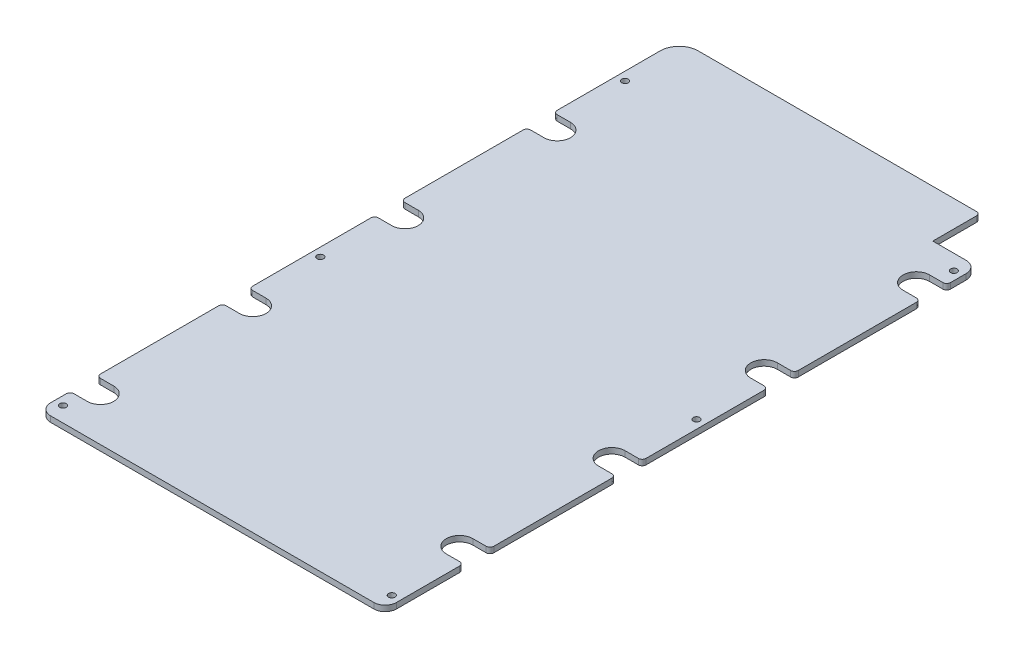
from build123d import *

# Parameters (mm, degrees)
BOSS_EXTRUDE1_DEPTH       = 3
FILLET1_R                 = 10
FILLET2_R                 = 6
F_4_CLEARANCE_HOLE1_D     = 3.4544
F_4_CLEARANCE_HOLE1_DEPTH = 3
F_4_CLEARANCE_HOLE1_TIP   = 1.037806461
FILLET3_R                 = 2


with BuildPart() as part:
    # Sketch1 → Boss-Extrude1 (new body)
    with BuildSketch(Plane(origin=(0, 0, 0), x_dir=(1, 0, 0), z_dir=(0, 1, 0))):
        with BuildLine():
            Line((-91.15, 34.609827366), (-82.15, 34.609827366))
            ThreePointArc((-82.15, 34.609827366), (-75.15, 27.609827366), (-82.15, 20.609827366))
            Line((-82.15, 20.609827366), (-91.15, 20.609827366))
            Line((-91.15, 20.609827366), (-91.15, -45.640172634))
            Line((-91.15, -45.640172634), (-82.15, -45.640172634))
            ThreePointArc((-82.15, -45.640172634), (-75.15, -52.640172634), (-82.15, -59.640172634))
            Line((-82.15, -59.640172634), (-91.15, -59.640172634))
            Line((-91.15, -59.640172634), (-91.15, -125.890172634))
            Line((-91.15, -125.890172634), (-82.15, -125.890172634))
            ThreePointArc((-82.15, -125.890172634), (-75.15, -132.890172634), (-82.15, -139.890172634))
            Line((-82.15, -139.890172634), (-91.15, -139.890172634))
            Line((-91.15, -139.890172634), (-91.15, -156.140172634))
            Line((-91.15, -156.140172634), (91.15, -156.140172634))
            Line((91.15, -156.140172634), (91.15, -114.890172634))
            Line((91.15, -114.890172634), (82.15, -114.890172634))
            ThreePointArc((82.15, -114.890172634), (75.15, -107.890172634), (82.15, -100.890172634))
            Line((82.15, -100.890172634), (91.15, -100.890172634))
            Line((91.15, -100.890172634), (91.15, -34.640172634))
            Line((91.15, -34.640172634), (82.15, -34.640172634))
            ThreePointArc((82.15, -34.640172634), (75.15, -27.640172634), (82.15, -20.640172634))
            Line((82.15, -20.640172634), (91.15, -20.640172634))
            Line((91.15, -20.640172634), (91.15, 45.609827366))
            Line((91.15, 45.609827366), (82.15, 45.609827366))
            ThreePointArc((82.15, 45.609827366), (75.15, 52.609827366), (82.15, 59.609827366))
            Line((82.15, 59.609827366), (91.15, 59.609827366))
            Line((91.15, 59.609827366), (91.15, 125.859827366))
            Line((91.15, 125.859827366), (82.15, 125.859827366))
            ThreePointArc((82.15, 125.859827366), (75.15, 132.859827366), (82.15, 139.859827366))
            Line((82.15, 139.859827366), (91.15, 139.859827366))
            Line((91.15, 139.859827366), (91.15, 156.140172634))
            Line((91.15, 156.140172634), (67.54, 156.140172634))
            Line((67.54, 156.140172634), (67.54, 181.140172634))
            Line((67.54, 181.140172634), (-91.15, 181.140172634))
            Line((-91.15, 181.140172634), (-91.15, 114.859827366))
            Line((-91.15, 114.859827366), (-82.15, 114.859827366))
            ThreePointArc((-82.15, 114.859827366), (-75.15, 107.859827366), (-82.15, 100.859827366))
            Line((-82.15, 100.859827366), (-91.15, 100.859827366))
            Line((-91.15, 100.859827366), (-91.15, 34.609827366))
        make_face()
    extrude(amount=BOSS_EXTRUDE1_DEPTH)

    # Fillet1
    fillet1_edges = [part.edges().sort_by_distance(p)[0] for p in [
        (-91.15, 1.5, -181.140172634),
    ]]
    fillet(fillet1_edges, radius=FILLET1_R)

    # Fillet2
    fillet2_edges = [part.edges().sort_by_distance(p)[0] for p in [
        (91.15, 1.5, 156.140172634),
        (-91.15, 1.5, 156.140172634),
        (91.15, 1.5, -156.140172634),
    ]]
    fillet(fillet2_edges, radius=FILLET2_R)

    # #4 Clearance Hole1
    with Locations(Plane(origin=(0, 3, 0), x_dir=(1, 0, 0), z_dir=(0, 1, 0))):
        with Locations((86.65, 148.140172634), (-86.65, -148.140172634), (-86.65, -12.515172634), (-86.65, 148.140172634), (86.65, 12.484827366), (86.65, -148.140172634)):
            Hole(F_4_CLEARANCE_HOLE1_D / 2, depth=F_4_CLEARANCE_HOLE1_DEPTH)
            with Locations((0, 0, -(F_4_CLEARANCE_HOLE1_DEPTH + F_4_CLEARANCE_HOLE1_TIP / 2))):  # 118° drill point
                Cone(0, F_4_CLEARANCE_HOLE1_D / 2, F_4_CLEARANCE_HOLE1_TIP, mode=Mode.SUBTRACT)

    # Fillet3
    fillet3_edges = [part.edges().sort_by_distance(p)[0] for p in [
        (-91.15, 1.5, -100.859827366),
        (-91.15, 1.5, -114.859827366),
        (-91.15, 1.5, -20.609827366),
        (-91.15, 1.5, -34.609827366),
        (-91.15, 1.5, 59.640172634),
        (-91.15, 1.5, 45.640172634),
        (-91.15, 1.5, 139.890172634),
        (-91.15, 1.5, 125.890172634),
        (91.15, 1.5, 100.890172634),
        (91.15, 1.5, 114.890172634),
        (91.15, 1.5, 34.640172634),
        (91.15, 1.5, 20.640172634),
        (91.15, 1.5, -45.609827366),
        (91.15, 1.5, -59.609827366),
        (91.15, 1.5, -125.859827366),
        (91.15, 1.5, -139.859827366),
        (67.54, 1.5, -181.140172634),
    ]]
    fillet(fillet3_edges, radius=FILLET3_R)


solid = part.part
